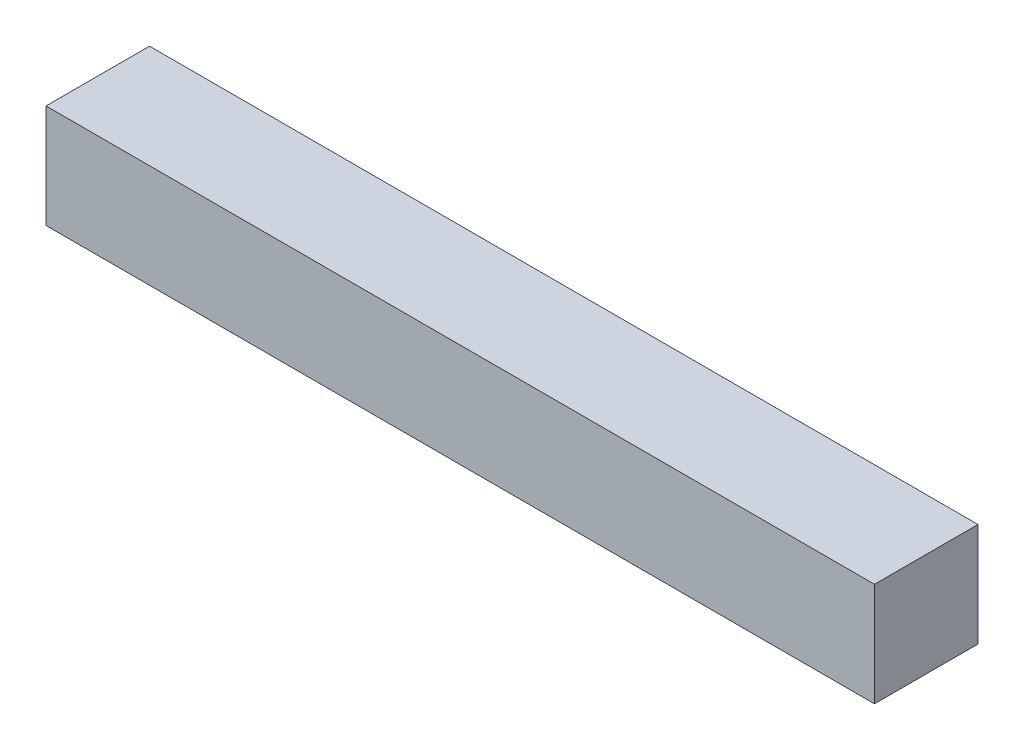
from build123d import *

# Parameters (mm, degrees)
LOFT1_START         = -0.580963743
LOFT1_OUTLINE_W     = 204.216
LOFT1_OUTLINE_H     = 204.216
LOFT1_DEPTH         = 1021.439287056
SKETCH3_3_W         = 204.216
SKETCH3_3_H         = 204.216
BOSS_EXTRUDE3_DEPTH = 306.324
SKETCH2_4_W         = 204.216
SKETCH2_4_H         = 204.216
BOSS_EXTRUDE5_DEPTH = 306.324


# Read off the part's stored shape, not the designer's step: Loft1
with BuildPart() as part:
    # Loft1 outline → Loft1 (new body)
    with BuildSketch(Plane.YZ.offset(LOFT1_START)):
        Rectangle(LOFT1_OUTLINE_W, LOFT1_OUTLINE_H)
    extrude(amount=LOFT1_DEPTH)

    # Sketch3<3> → Boss-Extrude3 (add)
    with BuildSketch(Plane(origin=(1020.858323313, 0, 0), x_dir=(0, 0, -1), z_dir=(1, 0, 0))):
        Rectangle(SKETCH3_3_W, SKETCH3_3_H)
    extrude(amount=BOSS_EXTRUDE3_DEPTH)

    # Sketch2<4> → Boss-Extrude5 (add)
    with BuildSketch(Plane(origin=(-0.580963743, 0, 0), x_dir=(0, 0, -1), z_dir=(1, 0, 0))):
        Rectangle(SKETCH2_4_W, SKETCH2_4_H)
    extrude(amount=-BOSS_EXTRUDE5_DEPTH)


solid = part.part
